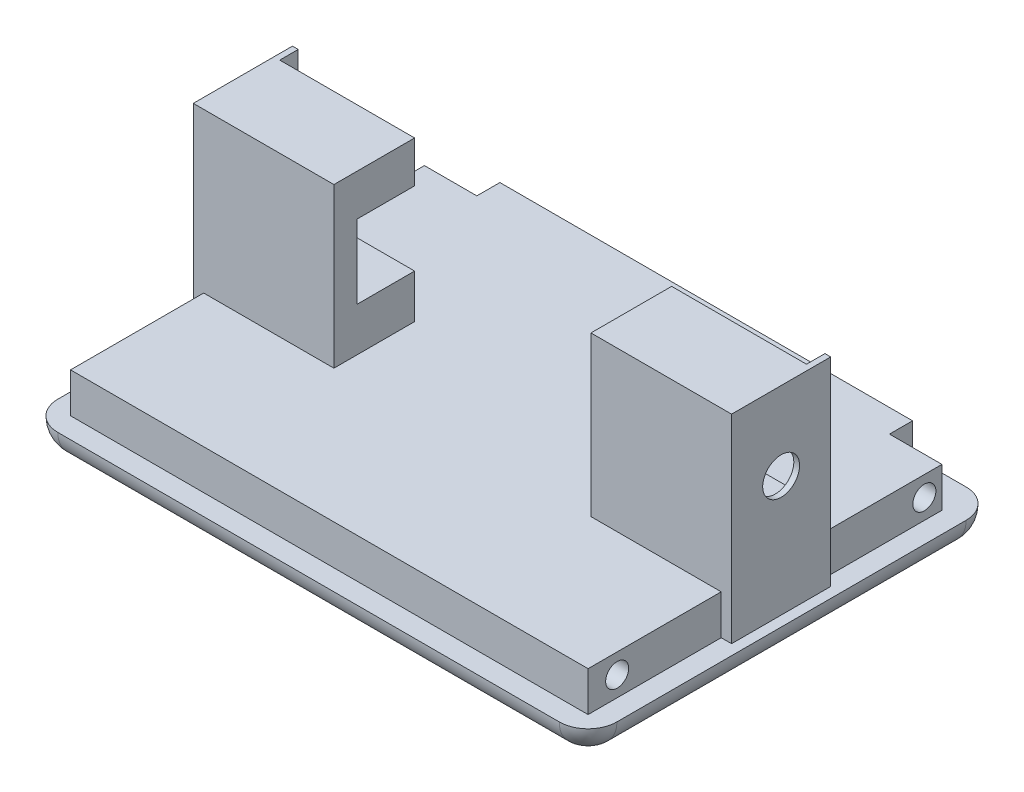
from build123d import *

# Parameters (mm, degrees)
SKETCH1_W               = 89.8
SKETCH1_H               = 61.4
BOSS_EXTRUDE1_DEPTH     = 6.9
SKETCH2_R               = 2
CUT_EXTRUDE1_DEPTH      = 4
SKETCH3_W               = 97
SKETCH3_H               = 70.6
BOSS_EXTRUDE2_DEPTH     = 5
SKETCH5_W               = 10.4
SKETCH5_H               = 6.9
SKETCH5_W_2             = 3.4
BOSS_EXTRUDE3_DEPTH     = 1.8
BOSS_EXTRUDE4_START     = 1.8
SKETCH5_3_W             = 10.4
SKETCH5_3_H             = 6.9
SKETCH5_3_H_2           = 27.6
SKETCH5_3_W_2           = 3.4
BOSS_EXTRUDE4_DEPTH     = 1
BOSS_EXTRUDE6_START     = -89.8
SKETCH5_5_W             = 3.4
SKETCH5_5_H             = 6.9
SKETCH5_5_W_2           = 10.4
BOSS_EXTRUDE6_DEPTH     = 1.8
BOSS_EXTRUDE7_START     = -91.6
SKETCH5_7_W             = 3.4
SKETCH5_7_H             = 6.9
SKETCH5_7_H_2           = 27.6
SKETCH5_7_W_2           = 10.4
BOSS_EXTRUDE7_DEPTH     = 1
CUT_EXTRUDE2_DEPTH      = 120.754123102
CUT_EXTRUDE2_DEPTH_BACK = 120.754123102
SKETCH6_R               = 3.2
BOSS_EXTRUDE9_START     = -24.4
BOSS_EXTRUDE9_DEPTH     = 23.4
BOSS_EXTRUDE10_START    = -92.4
SKETCH7_4_W             = 10
SKETCH7_4_H             = 7.6
SKETCH7_4_W_2           = 4
SKETCH7_4_H_2           = 7.2
BOSS_EXTRUDE10_DEPTH    = 23.4
SKETCH9_R               = 2
CUT_EXTRUDE3_DEPTH      = 4
MIRROR4_COPY_1_SKETCH_R = 2
MIRROR4_COPY_1_DEPTH    = 4
FILLET1_R               = 5
FILLET2_R               = 5
SKETCH12_R              = 2
CUT_EXTRUDE6_DEPTH      = 4


with BuildPart() as part:
    # Sketch1 → Boss-Extrude1 (new body)
    with BuildSketch(Plane(origin=(0, 0, 0), x_dir=(1, 0, 0), z_dir=(0, 1, 0))):
        with Locations((45.3, -31.1)):
            Rectangle(SKETCH1_W, SKETCH1_H)
        Polygon((81.1, 0), (81.1, 3.6), (9.5, 3.6), (9.5, 0), (9.5, -0.4), (81.1, -0.4), align=None)
    extrude(amount=BOSS_EXTRUDE1_DEPTH)

    # Sketch2 → Cut-Extrude1 (cut)
    with BuildSketch(Plane(origin=(90.2, 0, 0), x_dir=(0, 0, -1), z_dir=(1, 0, 0))):
        with Locations((-3.45, 3.45)):
            Circle(SKETCH2_R)
    cut_extrude1 = extrude(amount=-CUT_EXTRUDE1_DEPTH, mode=Mode.SUBTRACT)

    # Mirror1: Cut-Extrude1 across plane
    add(cut_extrude1.mirror(Plane(origin=(45.3, 0, 0), x_dir=(0, 0, 1), z_dir=(1, 0, 0))), mode=Mode.SUBTRACT)

    # Sketch3 → Boss-Extrude2 (add)
    with BuildSketch(Plane(origin=(0, 0, 0), x_dir=(1, 0, 0), z_dir=(0, 1, 0))):
        with Locations((45.3, -30.1)):
            Rectangle(SKETCH3_W, SKETCH3_H)
    extrude(amount=-BOSS_EXTRUDE2_DEPTH)

    # Sketch5 → Boss-Extrude3 (add)
    with BuildSketch(Plane.ZY.offset(-0.4)):
        with Locations((30.1, 3.45)):
            Rectangle(SKETCH5_W, SKETCH5_H)
        with Locations((23.2, 3.45)):
            Rectangle(SKETCH5_W_2, SKETCH5_H)
        with Locations((37, 3.45)):
            Rectangle(SKETCH5_W_2, SKETCH5_H)
    extrude(amount=BOSS_EXTRUDE3_DEPTH)

    # Sketch5<3> → Boss-Extrude4 (add)
    with BuildSketch(Plane.ZY.offset(-0.4).offset(BOSS_EXTRUDE4_START)):
        with Locations((30.1, 3.45)):
            Rectangle(SKETCH5_3_W, SKETCH5_3_H)
        with Locations((30.1, 20.7)):
            Rectangle(SKETCH5_3_W, SKETCH5_3_H_2)
        with Locations((23.2, 20.7)):
            Rectangle(SKETCH5_3_W_2, SKETCH5_3_H_2)
        with Locations((23.2, 3.45)):
            Rectangle(SKETCH5_3_W_2, SKETCH5_3_H)
        with Locations((37, 3.45)):
            Rectangle(SKETCH5_3_W_2, SKETCH5_3_H)
        with Locations((37, 20.7)):
            Rectangle(SKETCH5_3_W_2, SKETCH5_3_H_2)
    extrude(amount=-BOSS_EXTRUDE4_DEPTH)

    # Sketch5<5> → Boss-Extrude6 (add)
    with BuildSketch(Plane.ZY.offset(-0.4).offset(BOSS_EXTRUDE6_START)):
        with Locations((23.2, 3.45)):
            Rectangle(SKETCH5_5_W, SKETCH5_5_H)
        with Locations((37, 3.45)):
            Rectangle(SKETCH5_5_W, SKETCH5_5_H)
        with Locations((30.1, 3.45)):
            Rectangle(SKETCH5_5_W_2, SKETCH5_5_H)
    extrude(amount=-BOSS_EXTRUDE6_DEPTH)

    # Sketch5<7> → Boss-Extrude7 (add)
    with BuildSketch(Plane.ZY.offset(-0.4).offset(BOSS_EXTRUDE7_START)):
        with Locations((37, 3.45)):
            Rectangle(SKETCH5_7_W, SKETCH5_7_H)
        with Locations((37, 20.7)):
            Rectangle(SKETCH5_7_W, SKETCH5_7_H_2)
        with Locations((30.1, 20.7)):
            Rectangle(SKETCH5_7_W_2, SKETCH5_7_H_2)
        with Locations((23.2, 20.7)):
            Rectangle(SKETCH5_7_W, SKETCH5_7_H_2)
        with Locations((23.2, 3.45)):
            Rectangle(SKETCH5_7_W, SKETCH5_7_H)
        with Locations((30.1, 3.45)):
            Rectangle(SKETCH5_7_W_2, SKETCH5_7_H)
    extrude(amount=BOSS_EXTRUDE7_DEPTH)

    # Sketch6 → Cut-Extrude2 (cut, two sides: drawn at the far end of the back side and taken through both)
    with BuildSketch(Plane(origin=(-0.4, 0, 0), x_dir=(0, 0, -1), z_dir=(1, 0, 0)).offset(-CUT_EXTRUDE2_DEPTH_BACK)):
        with Locations((-30.1, 20.9)):
            Circle(SKETCH6_R)
    extrude(amount=CUT_EXTRUDE2_DEPTH + CUT_EXTRUDE2_DEPTH_BACK, mode=Mode.SUBTRACT)

    # Sketch7 → Boss-Extrude9 (add)
    with BuildSketch(Plane(origin=(92, 0, 0), x_dir=(0, 0, -1), z_dir=(1, 0, 0)).offset(BOSS_EXTRUDE9_START)):
        Polygon((-38.7, 34.5), (-38.7, 6.9), (-24.7, 6.9), (-24.7, 14.5), (-34.7, 14.5), (-34.7, 27.3), (-24.7, 27.3), (-24.7, 34.5), align=None)
    extrude(amount=BOSS_EXTRUDE9_DEPTH)

    # Sketch7<4> → Boss-Extrude10 (add)
    with BuildSketch(Plane(origin=(92, 0, 0), x_dir=(0, 0, -1), z_dir=(1, 0, 0)).offset(BOSS_EXTRUDE10_START)):
        with Locations((-29.7, 10.7)):
            Rectangle(SKETCH7_4_W, SKETCH7_4_H)
        with Locations((-36.7, 10.7)):
            Rectangle(SKETCH7_4_W_2, SKETCH7_4_H)
        with Locations((-36.7, 30.9)):
            Rectangle(SKETCH7_4_W_2, SKETCH7_4_H_2)
        with Locations((-29.7, 30.9)):
            Rectangle(SKETCH7_4_W, SKETCH7_4_H_2)
        Polygon((-38.7, 27.3), (-38.7, 20.9), (-38.7, 14.5), (-34.7, 14.5), (-34.7, 27.3), align=None)
    extrude(amount=BOSS_EXTRUDE10_DEPTH)

    # Sketch9 → Cut-Extrude3 (cut)
    with BuildSketch(Plane(origin=(0, 0, 24.7), x_dir=(-1, 0, 0), z_dir=(0, 0, -1))):
        with Locations(Location((-85.15, 30.9, 0), (0, 0, 90))):
            Circle(SKETCH9_R)
        with Locations(Location((-73.45, 30.9, 0), (0, 0, 270))):
            Circle(SKETCH9_R)
    cut_extrude3 = extrude(amount=-CUT_EXTRUDE3_DEPTH, mode=Mode.SUBTRACT)

    # Mirror3: Cut-Extrude3 across plane
    add(cut_extrude3.mirror(Plane(origin=(45.3, 0, 0), x_dir=(0, 0, 1), z_dir=(1, 0, 0))), mode=Mode.SUBTRACT)

    # Mirror4: Cut-Extrude3 across plane
    add(cut_extrude3.mirror(Plane.ZX.offset(20.7)), mode=Mode.SUBTRACT)

    # Mirror4 copy 1 sketch → Mirror4 copy 1 (cut)
    with BuildSketch(Plane(origin=(90.6, 41.4, 24.7), x_dir=(1, 0, 0), z_dir=(0, 0, -1))):
        with Locations(Location((-85.15, 30.9, 0), (0, 0, 90))):
            Circle(MIRROR4_COPY_1_SKETCH_R)
        with Locations(Location((-73.45, 30.9, 0), (0, 0, 270))):
            Circle(MIRROR4_COPY_1_SKETCH_R)
    extrude(amount=-MIRROR4_COPY_1_DEPTH, mode=Mode.SUBTRACT)

    # Fillet1
    fillet1_edges = [part.edges().sort_by_distance(p)[0] for p in [
        (93.8, -2.5, -5.2),
        (93.8, -2.5, 65.4),
        (-3.2, -2.5, 65.4),
        (-3.2, -2.5, -5.2),
    ]]
    fillet(fillet1_edges, radius=FILLET1_R)

    # Fillet2
    fillet2_edges = [part.edges().sort_by_distance(p)[0] for p in [
        (92.335533906, -5, 63.935533906),
        (93.8, -5, 30.1),
        (92.335533906, -5, -3.735533906),
        (45.3, -5, -5.2),
        (-1.735533906, -5, -3.735533906),
        (-3.2, -5, 30.1),
        (-1.735533906, -5, 63.935533906),
        (45.3, -5, 65.4),
    ]]
    fillet(fillet2_edges, radius=FILLET2_R - 0.0001)  # a hair under: the kernel refuses the full size

    # Sketch12 → Cut-Extrude6 (cut)
    with BuildSketch(Plane(origin=(90.2, 0, 0), x_dir=(0, 0, -1), z_dir=(1, 0, 0))):
        with Locations((-56.75, 3.45)):
            Circle(SKETCH12_R)
    cut_extrude6 = extrude(amount=-CUT_EXTRUDE6_DEPTH, mode=Mode.SUBTRACT)

    # Mirror5: Cut-Extrude6 across plane
    add(cut_extrude6.mirror(Plane(origin=(45.3, 0, 0), x_dir=(0, 0, 1), z_dir=(1, 0, 0))), mode=Mode.SUBTRACT)


solid = part.part
